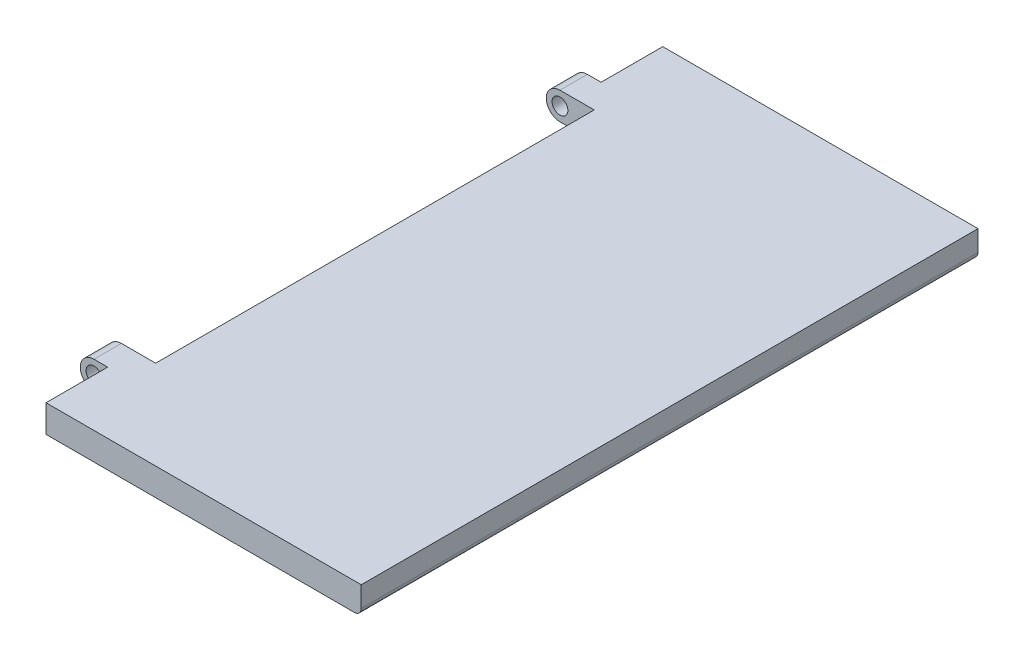
from build123d import *

# Parameters (mm, degrees)
SKETCH_2_W             = 46
SKETCH_2_H             = 4
EXTRUDE_1_DEPTH        = 90
SKETCH_3_W             = 4
SKETCH_3_H             = 4
EXTRUDE_2_DEPTH        = 4
FILLET_1_R             = 2
CUT_EXTRUDE_1_REACH    = 91.783
SKETCH_4_R             = 1.15
FILLET_1_OF_MIRROR_3_R = 2
FILLET_2_R             = 1
CHAMFER_1_SIZE         = 3


with BuildPart() as part:
    # 草图2 → 凸台-拉伸1 (new body)
    with BuildSketch(Plane.XY):
        with Locations((23, 2)):
            Rectangle(SKETCH_2_W, SKETCH_2_H)
    extrude(amount=EXTRUDE_1_DEPTH)

    # 草图3 → 凸台-拉伸2 (add)
    with BuildSketch(Plane.ZY):
        with Locations((11, 2)):
            Rectangle(SKETCH_3_W, SKETCH_3_H)
    extrude_2 = extrude(amount=EXTRUDE_2_DEPTH)

    # 圆角1
    fillet_1_edges = [part.edges().sort_by_distance(p)[0] for p in [
        (-4, 4, 11),
        (-4, 0, 11),
    ]]
    fillet(fillet_1_edges, radius=FILLET_1_R - 0.0001)  # a hair under: the kernel refuses the full size

    # 草图4 → 切除-拉伸1 (cut, up to next)
    with BuildSketch(Plane.XY.offset(13), mode=Mode.PRIVATE) as cut_extrude_1_sk1:
        with Locations((-2, 2)):
            Circle(SKETCH_4_R)
    cut_extrude_1_tool1 = extrude(cut_extrude_1_sk1.sketch, amount=-CUT_EXTRUDE_1_REACH, mode=Mode.PRIVATE) & part.part
    cut_extrude_1 = cut_extrude_1_tool1.solids().sort_by_distance((-2, 2, 13))[0]
    add(cut_extrude_1, mode=Mode.SUBTRACT)

    # 镜向3: 凸台-拉伸2, 切除-拉伸1 across plane
    add(extrude_2.mirror(Plane(origin=(0, 0, 45), x_dir=(1, 0, 0), z_dir=(0, 0, -1))))
    add(cut_extrude_1.mirror(Plane(origin=(0, 0, 45), x_dir=(1, 0, 0), z_dir=(0, 0, -1))), mode=Mode.SUBTRACT)

    # 圆角1 of 镜向3
    fillet_1_of_mirror_3_edges = [part.edges().sort_by_distance(p)[0] for p in [
        (-4, 4, 79),
        (-4, 0, 79),
    ]]
    fillet(fillet_1_of_mirror_3_edges, radius=FILLET_1_OF_MIRROR_3_R - 0.0001)  # a hair under: the kernel refuses the full size

    # 圆角2
    fillet_2_edges = [part.edges().sort_by_distance(p)[0] for p in [
        (46, 0, 45),
    ]]
    fillet(fillet_2_edges, radius=FILLET_2_R)

    # 倒角1
    chamfer_1_edges = [part.edges().sort_by_distance(p)[0] for p in [
        (0, 4, 45),
    ]]
    chamfer(chamfer_1_edges, length=CHAMFER_1_SIZE)


solid = part.part
